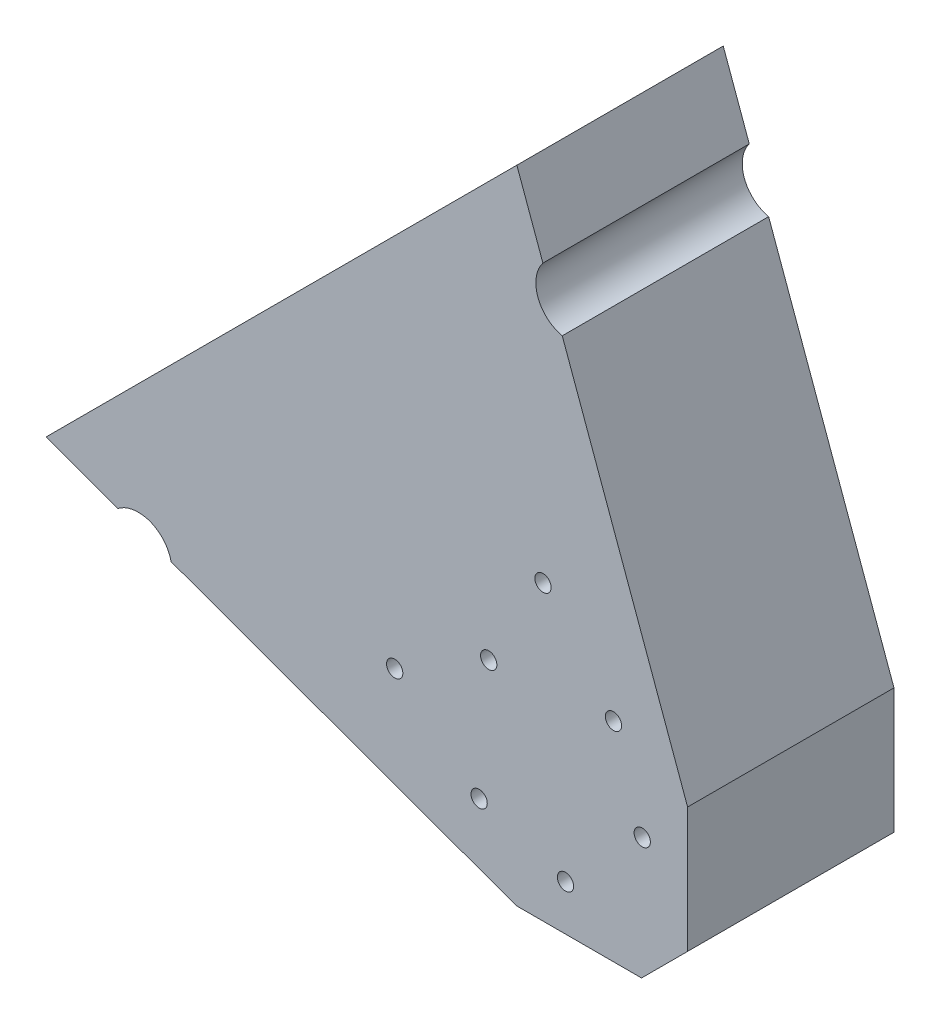
from build123d import *

# Parameters (mm, degrees)
BOSS_EXTRUDE1_DEPTH = 38.0226
SKETCH4_R           = 1.5
CUT_EXTRUDE2_DEPTH  = 209.836651908


with BuildPart() as part:
    # Sketch1 → Boss-Extrude1 (new body)
    with BuildSketch(Plane.XY):
        with BuildLine():
            Line((-58.458365937, 145.201634063), (-145.201634063, 58.458365937))
            Line((-145.201634063, 58.458365937), (-131.978806525, 53.659274755))
            ThreePointArc((-131.978806525, 53.659274755), (-126.085392755, 54.587644502), (-122.159336774, 50.095397772))
            Line((-122.159336774, 50.095397772), (-58.525108947, 27))
            Line((-58.525108947, 27), (-35.485281374, 27))
            Line((-35.485281374, 27), (-27, 35.485281374))
            Line((-27, 35.485281374), (-27, 58.525108947))
            Line((-27, 58.525108947), (-50.095397772, 122.159336774))
            ThreePointArc((-50.095397772, 122.159336774), (-54.587644502, 126.085392755), (-53.659274755, 131.978806525))
            Line((-53.659274755, 131.978806525), (-58.458365937, 145.201634063))
        make_face()
    extrude(amount=BOSS_EXTRUDE1_DEPTH)

    # Sketch4 → Cut-Extrude2 (cut, through all)
    with BuildSketch(Plane.XY.offset(38.0226)):
        with Locations((-63.639610307, 63.639610307)):
            Circle(SKETCH4_R)
        with Locations((-80.960118382, 53.639610307)):
            Circle(SKETCH4_R)
        with Locations((-53.639610307, 80.960118382)):
            Circle(SKETCH4_R)
        with Locations((-40.658639918, 65.40737726)):
            Circle(SKETCH4_R)
        with Locations((-65.40737726, 40.658639918)):
            Circle(SKETCH4_R)
        with Locations((-49.497474683, 35.355339059)):
            Circle(SKETCH4_R)
        with Locations((-35.355339059, 49.497474683)):
            Circle(SKETCH4_R)
    extrude(amount=-CUT_EXTRUDE2_DEPTH, mode=Mode.SUBTRACT)


solid = part.part
